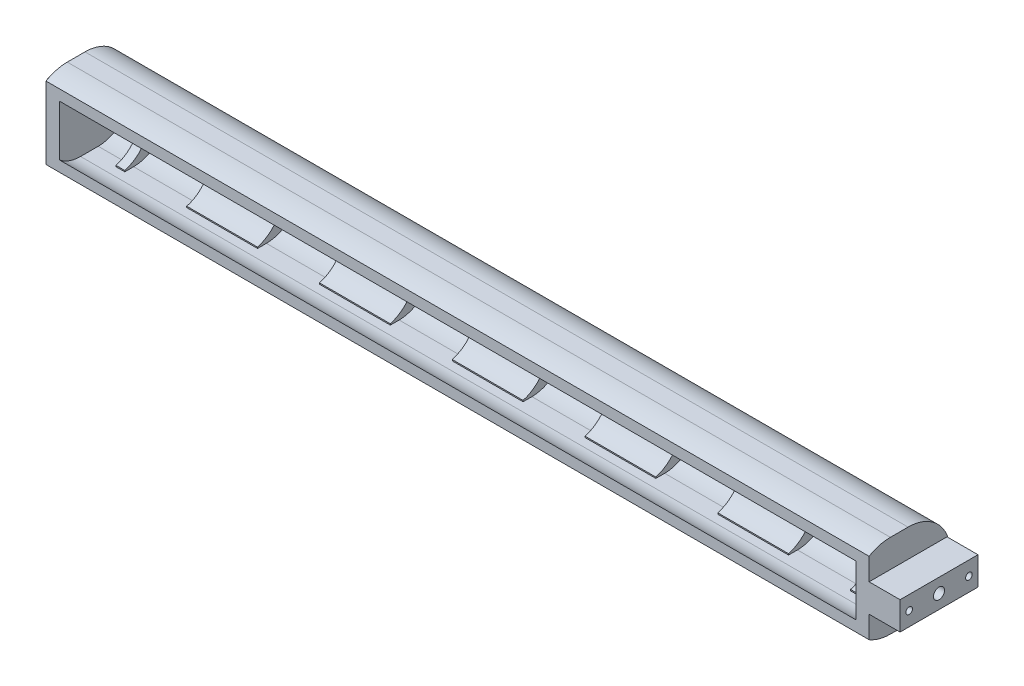
from build123d import *

# Parameters (mm, degrees)
AUFSATZ_LINEAR_AUSTRAGEN1_DEPTH = 180
AUFSATZ_LINEAR_START            = -10
SKIZZE3_W                       = 2
SKIZZE3_H                       = 15
AUFSATZ_LINEAR_AUSTRAGEN2_DEPTH = 10
SKIZZE11_W                      = 12
SKIZZE11_H                      = 15
AUFSATZ_LINEAR_AUSTRAGEN6_DEPTH = 10
SCHNITT_LINEAR_AUSTRAGEN3_DEPTH = 200
AUFSATZ_LINEAR_AUSTRAGEN3_DEPTH = 3
SKIZZE9_W                       = 17.608625436
SKIZZE9_H                       = 6.338284118
AUFSATZ_LINEAR_AUSTRAGEN5_DEPTH = 7
SKIZZE10_R                      = 0.75
SKIZZE10_R_2                    = 1.25
SCHNITT_LINEAR_AUSTRAGEN5_DEPTH = 7
AUFSATZ_LINEAR_START_2          = 3
AUFSATZ_LINEAR_AUSTRAGEN7_DEPTH = 3
SKIZZE13_W                      = 7
SKIZZE13_H                      = 7
AUFSATZ_LINEAR_AUSTRAGEN8_DEPTH = 5
SKIZZE15_R                      = 1.75
SCHNITT_LINEAR_AUSTRAGEN6_DEPTH = 5


with BuildPart() as part:
    # Skizze2 → Aufsatz-Linear austragen1 (new body)
    with BuildSketch(Plane(origin=(0, 0, 0), x_dir=(0, 0, -1), z_dir=(1, 0, 0))):
        with BuildLine():
            ThreePointArc((-6.804312718, 5.759216901), (-4.554982705, 7.051387337), (-2, 7.5))
            Line((-2, 7.5), (2, 7.5))
            ThreePointArc((2, 7.5), (9.5, 0), (2, -7.5))
            Line((2, -7.5), (-2, -7.5))
            ThreePointArc((-2, -7.5), (-4.554982705, -7.051387337), (-6.804312718, -5.759216901))
            Line((-6.804312718, -5.759216901), (-6.804312718, -8.195643923))
            ThreePointArc((-6.804312718, -8.195643923), (-4.489114575, -9.16811369), (-2, -9.5))
            Line((-2, -9.5), (2, -9.5))
            ThreePointArc((2, -9.5), (11.5, 0), (2, 9.5))
            Line((2, 9.5), (-2, 9.5))
            ThreePointArc((-2, 9.5), (-4.489114575, 9.16811369), (-6.804312718, 8.195643923))
            Line((-6.804312718, 8.195643923), (-6.804312718, 5.759216901))
        make_face()
    extrude(amount=AUFSATZ_LINEAR_AUSTRAGEN1_DEPTH)

    # Skizze3 → Aufsatz-Linear austragen2 (add)
    with BuildSketch(Plane.XY.offset(AUFSATZ_LINEAR_START)):
        with Locations((37, 0)):
            Rectangle(SKIZZE3_W, SKIZZE3_H)
        with Locations((7, 0)):
            Rectangle(SKIZZE3_W, SKIZZE3_H)
        with Locations((23, 0)):
            Rectangle(SKIZZE3_W, SKIZZE3_H)
        with Locations((53, 0)):
            Rectangle(SKIZZE3_W, SKIZZE3_H)
        with Locations((67, 0)):
            Rectangle(SKIZZE3_W, SKIZZE3_H)
        with Locations((83, 0)):
            Rectangle(SKIZZE3_W, SKIZZE3_H)
        with Locations((97, 0)):
            Rectangle(SKIZZE3_W, SKIZZE3_H)
        with Locations((113, 0)):
            Rectangle(SKIZZE3_W, SKIZZE3_H)
        with Locations((127, 0)):
            Rectangle(SKIZZE3_W, SKIZZE3_H)
        with Locations((143, 0)):
            Rectangle(SKIZZE3_W, SKIZZE3_H)
        with Locations((157, 0)):
            Rectangle(SKIZZE3_W, SKIZZE3_H)
        with Locations((173, 0)):
            Rectangle(SKIZZE3_W, SKIZZE3_H)
    extrude(amount=AUFSATZ_LINEAR_AUSTRAGEN2_DEPTH)

    # Skizze11 → Aufsatz-Linear austragen6 (add)
    with BuildSketch(Plane.XY.offset(AUFSATZ_LINEAR_START)):
        with Locations((30, 0)):
            Rectangle(SKIZZE11_W, SKIZZE11_H)
        with Locations((60, 0)):
            Rectangle(SKIZZE11_W, SKIZZE11_H)
        with Locations((90, 0)):
            Rectangle(SKIZZE11_W, SKIZZE11_H)
        with Locations((120, 0)):
            Rectangle(SKIZZE11_W, SKIZZE11_H)
        with Locations((150, 0)):
            Rectangle(SKIZZE11_W, SKIZZE11_H)
    extrude(amount=AUFSATZ_LINEAR_AUSTRAGEN6_DEPTH)

    # Skizze5 → Schnitt-Linear austragen3 (cut)
    with BuildSketch(Plane(origin=(0, 0, 0), x_dir=(0, 0, -1), z_dir=(1, 0, 0))):
        with BuildLine():
            ThreePointArc((0, -7.228416147), (5.5, 0), (0, 7.228416147))
            Line((0, 7.228416147), (0, -7.228416147))
        make_face()
        with BuildLine():
            ThreePointArc((2, 9.47585653), (11.47585653, 0), (2, -9.47585653))
            Line((2, -9.47585653), (-2, -9.47585653))
            ThreePointArc((-2, -9.47585653), (-5.40264982, -8.843858388), (-8.35141595, -7.032166979))
            ThreePointArc((-8.35141595, -7.032166979), (14.514119409, 0), (-8.35141595, 7.032166979))
            ThreePointArc((-8.35141595, 7.032166979), (-5.40264982, 8.843858388), (-2, 9.47585653))
            Line((-2, 9.47585653), (2, 9.47585653))
        make_face()
    extrude(amount=SCHNITT_LINEAR_AUSTRAGEN3_DEPTH, mode=Mode.SUBTRACT)

    # Skizze6 → Aufsatz-Linear austragen3 (add)
    with BuildSketch(Plane(origin=(180, 0, 0), x_dir=(0, 0, -1), z_dir=(1, 0, 0))):
        with BuildLine():
            ThreePointArc((-2, 9.47585653), (-4.489620265, 9.142956192), (-6.804312718, 8.167645701))
            Line((-6.804312718, 8.167645701), (-6.804312718, -8.167645701))
            ThreePointArc((-6.804312718, -8.167645701), (-4.489620265, -9.142956192), (-2, -9.47585653))
            Line((-2, -9.47585653), (2, -9.47585653))
            ThreePointArc((2, -9.47585653), (11.47585653, 0), (2, 9.47585653))
            Line((2, 9.47585653), (-2, 9.47585653))
        make_face()
    extrude(amount=AUFSATZ_LINEAR_AUSTRAGEN3_DEPTH)

    # Skizze9 → Aufsatz-Linear austragen5 (add)
    with BuildSketch(Plane(origin=(183, 0, 0), x_dir=(0, 0, -1), z_dir=(1, 0, 0))):
        with Locations((2, 0)):
            Rectangle(SKIZZE9_W, SKIZZE9_H)
    extrude(amount=AUFSATZ_LINEAR_AUSTRAGEN5_DEPTH)

    # Skizze10 → Schnitt-Linear austragen5 (cut)
    with BuildSketch(Plane(origin=(190, 0, 0), x_dir=(0, 0, -1), z_dir=(1, 0, 0))):
        with Locations((-4.75, 0)):
            Circle(SKIZZE10_R)
        with Locations((8.75, 0)):
            Circle(SKIZZE10_R)
        with Locations((2, 0)):
            Circle(SKIZZE10_R_2)
    extrude(amount=-SCHNITT_LINEAR_AUSTRAGEN5_DEPTH, mode=Mode.SUBTRACT)

    # Skizze12 → Aufsatz-Linear austragen7 (add)
    with BuildSketch(Plane.ZY.offset(AUFSATZ_LINEAR_START_2)):
        with BuildLine():
            ThreePointArc((6.804312718, 8.167645701), (4.489620265, 9.142956192), (2, 9.47585653))
            Line((2, 9.47585653), (-2, 9.47585653))
            ThreePointArc((-2, 9.47585653), (-11.47585653, 0), (-2, -9.47585653))
            Line((-2, -9.47585653), (2, -9.47585653))
            ThreePointArc((2, -9.47585653), (4.489620265, -9.142956192), (6.804312718, -8.167645701))
            Line((6.804312718, -8.167645701), (6.804312718, 8.167645701))
        make_face()
    extrude(amount=-AUFSATZ_LINEAR_AUSTRAGEN7_DEPTH)

    # Skizze13 → Aufsatz-Linear austragen8 (add)
    with BuildSketch(Plane.ZY.offset(3)):
        with Locations((-2, 0)):
            Rectangle(SKIZZE13_W, SKIZZE13_H)
    extrude(amount=AUFSATZ_LINEAR_AUSTRAGEN8_DEPTH)

    # Skizze15 → Schnitt-Linear austragen6 (cut)
    with BuildSketch(Plane.ZY.offset(8)):
        with Locations((-2, 0)):
            Circle(SKIZZE15_R)
    extrude(amount=-SCHNITT_LINEAR_AUSTRAGEN6_DEPTH, mode=Mode.SUBTRACT)


solid = part.part
